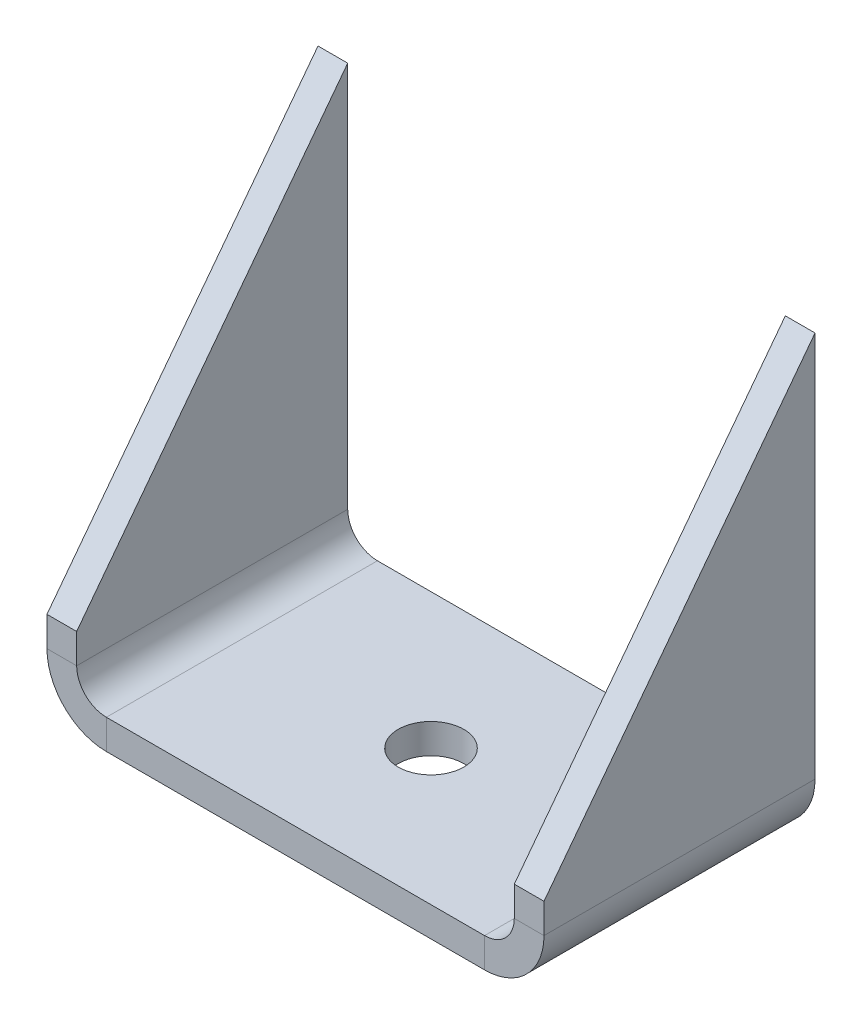
from build123d import *

# Parameters (mm, degrees)
SKETCH3_W                      = 53.099999972
SKETCH3_H                      = 28.956
BASE_FLANGE1_DEPTH             = 3.175
EDGE_FLANGE4_STRIP_W           = 19.05
EDGE_FLANGE4_STRIP_H           = 3.175
EDGE_FLANGE4_STRIP_CUT_DEPTH   = 28.956
EDGE_FLANGE4_STRIP_2_W         = 19.05
EDGE_FLANGE4_STRIP_2_H         = 3.175
EDGE_FLANGE4_STRIP_CUT_2_DEPTH = 28.956
EDGE_FLANGE4_DEPTH             = 28.956
EDGE_FLANGE4_FLAT_DEPTH        = 3.175
EDGE_FLANGE4_BEND_DEPTH        = 28.956
EDGE_FLANGE4_FLAT_2_DEPTH      = 3.175
M6_CLEARANCE_HOLE1_D           = 7


# Sheet-metal steps are written as plain solids
with BuildPart() as part:
    # Sketch3 → Base-Flange1 (new body)
    with BuildSketch(Plane(origin=(0, 0, 0), x_dir=(1, 0, 0), z_dir=(0, 1, 0))):
        with Locations((26.549999986, 14.478)):
            Rectangle(SKETCH3_W, SKETCH3_H)
    extrude(amount=-BASE_FLANGE1_DEPTH)

    # Edge-Flange4 strip (across the edge) → Edge-Flange4 strip cut (cut)
    with BuildSketch(Plane(origin=(53.099999972, 0, 0), x_dir=(-1, 0, 0), z_dir=(0, 0, -1))):
        with Locations((-3.175, -1.5875)):
            Rectangle(EDGE_FLANGE4_STRIP_W, EDGE_FLANGE4_STRIP_H)
    extrude(amount=EDGE_FLANGE4_STRIP_CUT_DEPTH, mode=Mode.SUBTRACT)

    # Edge-Flange4 strip 2 (across the edge) → Edge-Flange4 strip cut 2 (cut)
    with BuildSketch(Plane.XY.offset(-28.956)):
        with Locations((-3.175, -1.5875)):
            Rectangle(EDGE_FLANGE4_STRIP_2_W, EDGE_FLANGE4_STRIP_2_H)
    extrude(amount=EDGE_FLANGE4_STRIP_CUT_2_DEPTH, mode=Mode.SUBTRACT)

    # Edge-Flange4 bend section (across the edge) → Edge-Flange4 (add)
    with BuildSketch(Plane(origin=(53.099999972, 0, 0), x_dir=(-1, 0, 0), z_dir=(0, 0, -1))):
        with BuildLine():
            Line((0, 3.175), (3.175, 3.175))
            ThreePointArc((3.175, 3.175), (4.10493597, 0.92993597), (6.35, 0))
            Line((6.35, 0), (6.35, -3.175))
            ThreePointArc((6.35, -3.175), (1.859871939, -1.315128061), (0, 3.175))
        make_face()
    extrude(amount=EDGE_FLANGE4_DEPTH)

    # Edge-Flange4 profile (on flange) → Edge-Flange4 flat (add)
    with BuildSketch(Plane(origin=(53.099999972, 0, 0), x_dir=(0, 0, -1), z_dir=(1, 0, 0))):
        Polygon((0, 6.35), (0, 3.175), (28.956, 3.175), (28.956, 44.45), align=None)
    extrude(amount=-EDGE_FLANGE4_FLAT_DEPTH)

    # Edge-Flange4 bend section 2 (across the edge) → Edge-Flange4 bend (add)
    with BuildSketch(Plane.XY.offset(-28.956)):
        with BuildLine():
            Line((0, 3.175), (3.175, 3.175))
            ThreePointArc((3.175, 3.175), (4.10493597, 0.92993597), (6.35, 0))
            Line((6.35, 0), (6.35, -3.175))
            ThreePointArc((6.35, -3.175), (1.859871939, -1.315128061), (0, 3.175))
        make_face()
    extrude(amount=EDGE_FLANGE4_BEND_DEPTH)

    # Edge-Flange4 profile 2 (on flange) → Edge-Flange4 flat 2 (add)
    with BuildSketch(Plane.ZY):
        Polygon((-28.956, 44.45), (-28.956, 3.175), (0, 3.175), (0, 6.35), align=None)
    extrude(amount=-EDGE_FLANGE4_FLAT_2_DEPTH)

    # M6 Clearance Hole1 (through all)
    with Locations(Plane(origin=(0, 0, 0), x_dir=(1, 0, 0), z_dir=(0, 1, 0))):
        with Locations((26.549999986, 14.478)):
            Hole(M6_CLEARANCE_HOLE1_D / 2)


solid = part.part
